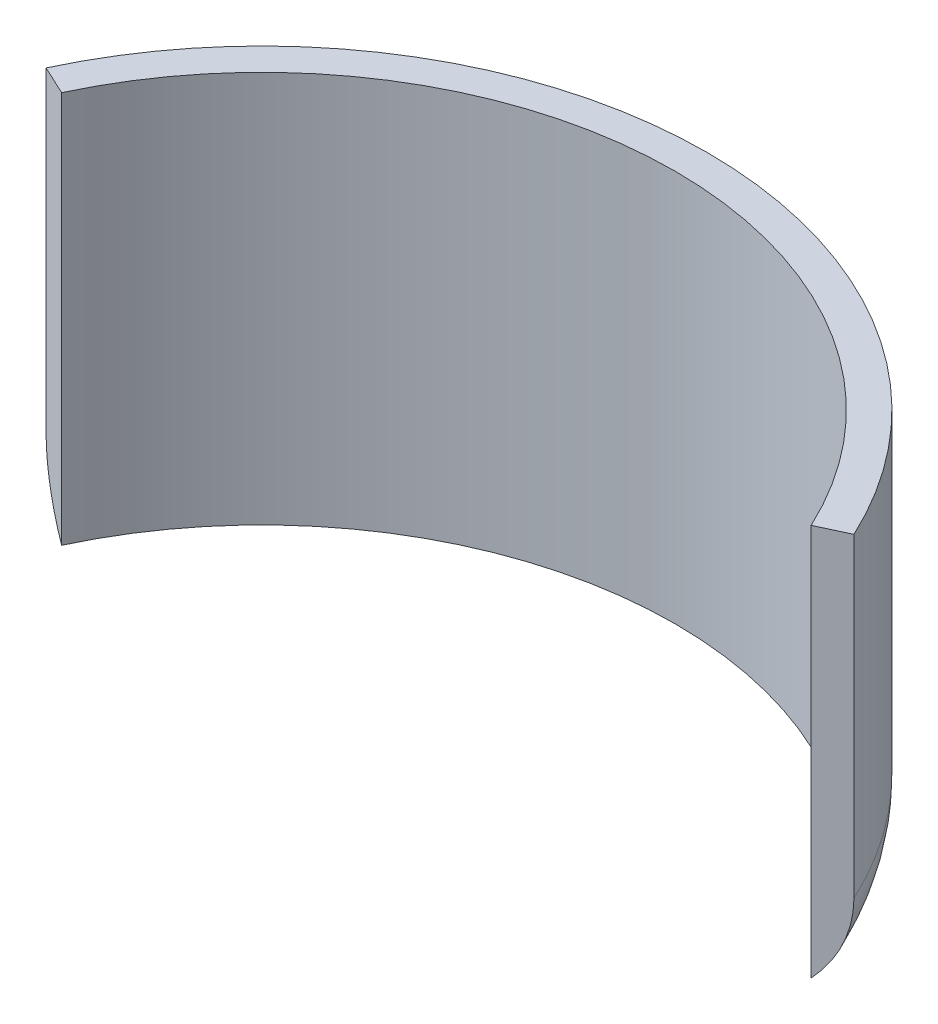
from build123d import *

# Parameters (mm, degrees)
SKETCH2_W                = 3
SKETCH2_H                = 36.5
REVOLVE1_ANGLE           = 65
REVOLVE1_OTHER_WAY_ANGLE = 65
FILLET1_R                = 10


with BuildPart() as part:
    # Sketch2 → Revolve1 (revolve)
    with BuildSketch(Plane(origin=(0, 0, 0), x_dir=(0, 0, -1), z_dir=(1, 0, 0))):
        Rectangle(SKETCH2_W, SKETCH2_H)
    revolve(axis=Axis((0, 51.098803243, 40), (0, -1, 0)), revolution_arc=REVOLVE1_ANGLE)

    # Sketch2 → Revolve1 other way (revolve)
    with BuildSketch(Plane(origin=(0, 0, 0), x_dir=(0, 0, -1), z_dir=(1, 0, 0))):
        Rectangle(SKETCH2_W, SKETCH2_H)
    revolve(axis=Axis((0, 51.098803243, 40), (0, 1, 0)), revolution_arc=REVOLVE1_OTHER_WAY_ANGLE)

    # Fillet1
    # the kernel refuses this fillet: 10 mm, written as the material it takes off along each edge
    with BuildSketch(Plane(origin=(0, -18.25, 40), x_dir=(0.9999833818501401, 0, -0.005765069258622961), z_dir=(0.005765069258622961, 0, 0.9999833818501401))) as fillet1_piece_1:
        with BuildLine():
            CenterArc((31.5, 7.141428429), FILLET1_R, 314.427004001, 45.572995999)
            Line((41.5, 7.141428429), (41.7, 7.141428429))
            Line((41.7, 7.141428429), (41.7, 0))
            Line((41.7, 0), (41.5, -0.2))
            ThreePointArc((41.5, -0.2), (40, -0.2), (38.64, -0.142828569))
            Line((38.64, -0.142828569), (38.5, 0))
        make_face()
    revolve(axis=Axis((0, -18.25, 40), (0, 1, 0)), revolution_arc=179.339368066, mode=Mode.SUBTRACT)


solid = part.part
